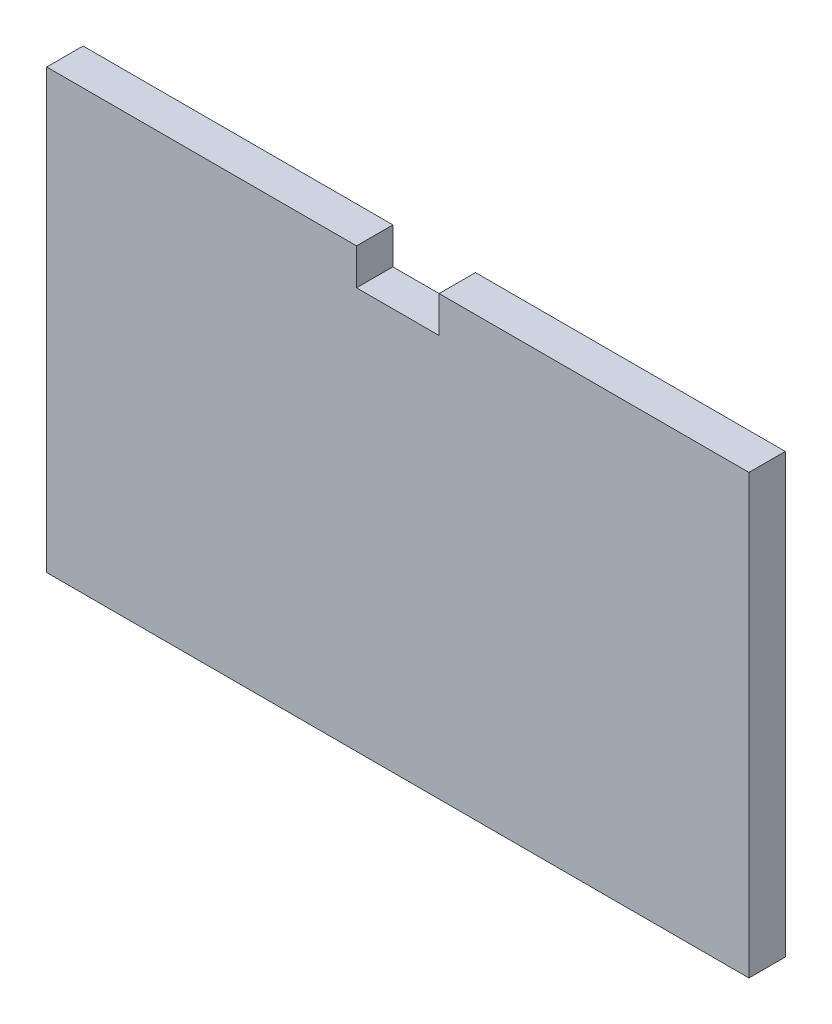
from build123d import *

# Parameters (mm, degrees)
BOSS_EXTRUDE1_DEPTH = 2.794


with BuildPart() as part:
    # Sketch1 → Boss-Extrude1 (new, symmetric)
    with BuildSketch(Plane.XY):
        Polygon((-6.35, 33.655), (-6.35, 28.067), (6.35, 28.067), (6.35, 33.655), (53.975, 33.655), (53.975, -33.655), (-53.975, -33.655), (-53.975, 33.655), align=None)
    extrude(amount=BOSS_EXTRUDE1_DEPTH, both=True)


solid = part.part
